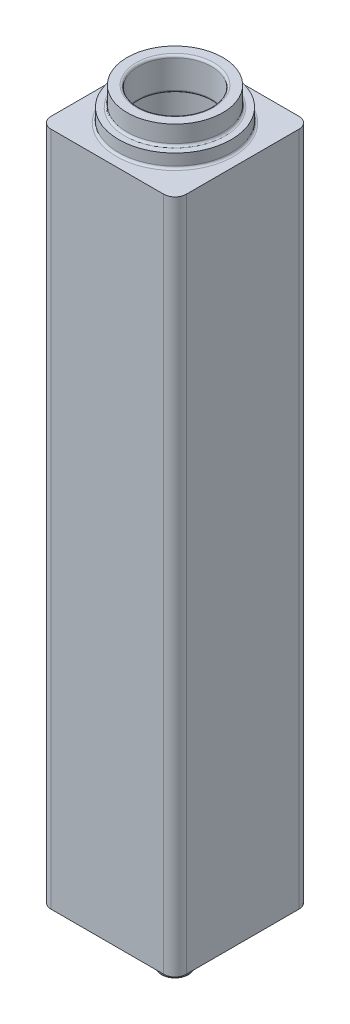
from build123d import *

# Parameters (mm, degrees)
ESQUISSE1_W             = 120
ESQUISSE1_H             = 120
BOSS_EXTRU_1_DEPTH      = 600
CONG_1_R                = 10
CONG_2_R                = 10
CONG_3_R                = 10
CONG_4_R                = 10
ESQUISSE2_R             = 42.5
BOSS_EXTRU_2_DEPTH      = 29
ESQUISSE4_R             = 50
BOSS_EXTRU_3_DEPTH      = 12
ESQUISSE8_R             = 45
BOSS_EXTRU_4_DEPTH      = 12
ESQUISSE9_R             = 12.5
BOSS_EXTRU_5_DEPTH      = 50
ESQUISSE5_R             = 35
ENL_V_MAT_EXTRU_1_DEPTH = 590
CONG_5_R                = 2
CONG_6_R                = 2
CONG_7_R                = 2
ESQUISSE11_R            = 32.5
ENL_V_MAT_EXTRU_3_DEPTH = 29
CONG_9_R                = 2
CONG_11_R               = 2
CONG_12_R               = 2


with BuildPart() as part:
    # Esquisse1 → Boss.-Extru.1 (new body)
    with BuildSketch(Plane(origin=(0, 0, 0), x_dir=(1, 0, 0), z_dir=(0, 1, 0))):
        Rectangle(ESQUISSE1_W, ESQUISSE1_H)
    extrude(amount=BOSS_EXTRU_1_DEPTH)

    # Congé1
    cong_1_edges = [part.edges().sort_by_distance(p)[0] for p in [
        (60, 300, 60),
    ]]
    fillet(cong_1_edges, radius=CONG_1_R)

    # Congé2
    cong_2_edges = [part.edges().sort_by_distance(p)[0] for p in [
        (60, 300, -60),
    ]]
    fillet(cong_2_edges, radius=CONG_2_R)

    # Congé3
    cong_3_edges = [part.edges().sort_by_distance(p)[0] for p in [
        (-60, 300, -60),
    ]]
    fillet(cong_3_edges, radius=CONG_3_R)

    # Congé4
    cong_4_edges = [part.edges().sort_by_distance(p)[0] for p in [
        (-60, 300, 60),
    ]]
    fillet(cong_4_edges, radius=CONG_4_R)

    # Esquisse2 → Boss.-Extru.2 (add)
    with BuildSketch(Plane(origin=(0, 600, 0), x_dir=(1, 0, 0), z_dir=(0, 1, 0))):
        Circle(ESQUISSE2_R)
    extrude(amount=BOSS_EXTRU_2_DEPTH)

    # Esquisse4 → Boss.-Extru.3 (add)
    with BuildSketch(Plane(origin=(0, 600, 0), x_dir=(1, 0, 0), z_dir=(0, 1, 0))):
        Circle(ESQUISSE4_R)
    extrude(amount=BOSS_EXTRU_3_DEPTH)

    # Esquisse8 → Boss.-Extru.4 (add)
    with BuildSketch(Plane.XZ):
        Circle(ESQUISSE8_R)
    extrude(amount=BOSS_EXTRU_4_DEPTH)

    # Esquisse9 → Boss.-Extru.5 (add)
    with BuildSketch(Plane.XZ):
        Circle(ESQUISSE9_R)
    extrude(amount=BOSS_EXTRU_5_DEPTH)

    # Esquisse5 → Enlèv. mat.-Extru.1 (cut)
    with BuildSketch(Plane(origin=(0, 600, 0), x_dir=(1, 0, 0), z_dir=(0, 1, 0))):
        Circle(ESQUISSE5_R)
    extrude(amount=-ENL_V_MAT_EXTRU_1_DEPTH, mode=Mode.SUBTRACT)

    # Congé5
    cong_5_edges = [part.edges().sort_by_distance(p)[0] for p in [
        (-45, -12, 0),
        (-12.5, -12, 0),
    ]]
    fillet(cong_5_edges, radius=CONG_5_R)

    # Congé6
    cong_6_edges = [part.edges().sort_by_distance(p)[0] for p in [
        (-12.5, -50, 0),
    ]]
    fillet(cong_6_edges, radius=CONG_6_R)

    # Congé7
    cong_7_edges = [part.edges().sort_by_distance(p)[0] for p in [
        (-50, 600, 0),
    ]]
    fillet(cong_7_edges, radius=CONG_7_R)

    # Esquisse11 → Enlèv. mat.-Extru.3 (cut)
    with BuildSketch(Plane(origin=(0, 629, 0), x_dir=(1, 0, 0), z_dir=(0, 1, 0))):
        Circle(ESQUISSE11_R)
    extrude(amount=-ENL_V_MAT_EXTRU_3_DEPTH, mode=Mode.SUBTRACT)

    # Congé9
    cong_9_edges = [part.edges().sort_by_distance(p)[0] for p in [
        (-32.5, 600, 0),
    ]]
    fillet(cong_9_edges, radius=CONG_9_R)

    # Congé11
    cong_11_edges = [part.edges().sort_by_distance(p)[0] for p in [
        (-42.5, 612, 0),
    ]]
    fillet(cong_11_edges, radius=CONG_11_R)

    # Congé12
    cong_12_edges = [part.edges().sort_by_distance(p)[0] for p in [
        (-32.5, 629, 0),
    ]]
    fillet(cong_12_edges, radius=CONG_12_R)


solid = part.part
